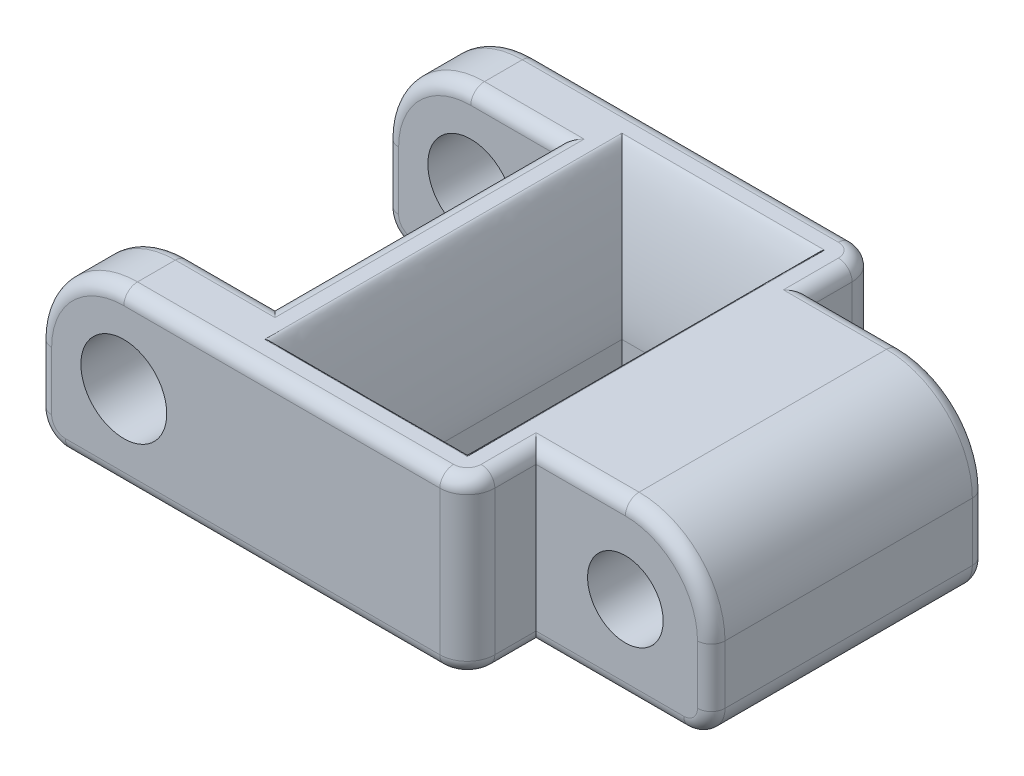
from build123d import *

# Parameters (mm, degrees)
BOSS_EXTRUDE1_DEPTH     = 5
CUT_EXTRUDE1_DEPTH      = 21.850899261
CUT_EXTRUDE1_DEPTH_BACK = 21.850899261
SKETCH2_R               = 1.1
SKETCH2_R_2             = 1.25
SKETCH3_W               = 3.5
SKETCH3_H               = 8
CUT_EXTRUDE2_DEPTH      = 22.880585001
FILLET1_R               = 2.5
FILLET2_SIZE            = 1.2
FILLET2_SIZE_2          = 4
FILLET3_R               = 0.8
FILLET4_R               = 0.4


with BuildPart() as part:
    # Sketch1 → Boss-Extrude1 (new body)
    with BuildSketch(Plane(origin=(0, 0, 0), x_dir=(1, 0, 0), z_dir=(0, 1, 0))):
        Polygon((0, -10.1), (0, -12), (12.5, -12), (12.5, -10), (17.6, -10), (17.6, -2), (12.5, -2), (12.5, 0), (0, 0), (0, -1.9), (5, -1.9), (5, -10.1), align=None)
    extrude(amount=BOSS_EXTRUDE1_DEPTH)

    # Sketch2 → Cut-Extrude1 (cut, two sides: drawn at the far end of the back side and taken through both)
    with BuildSketch(Plane.XY.offset(10).offset(-CUT_EXTRUDE1_DEPTH_BACK)):
        with Locations((15.1, 2.5)):
            Circle(SKETCH2_R)
        with Locations((2.5, 2.5)):
            Circle(SKETCH2_R_2)
    extrude(amount=CUT_EXTRUDE1_DEPTH + CUT_EXTRUDE1_DEPTH_BACK, mode=Mode.SUBTRACT)

    # Sketch3 → Cut-Extrude2 (cut, through all)
    with BuildSketch(Plane(origin=(0, 5, 0), x_dir=(1, 0, 0), z_dir=(0, 1, 0))):
        with Locations((8.75, -6)):
            Rectangle(SKETCH3_W, SKETCH3_H)
    extrude(amount=-CUT_EXTRUDE2_DEPTH, mode=Mode.SUBTRACT)

    # Fillet1
    fillet1_edges = [part.edges().sort_by_distance(p)[0] for p in [
        (0, 5, 11.05),
        (17.6, 5, 6),
        (0, 5, 0.95),
    ]]
    fillet(fillet1_edges, radius=FILLET1_R)

    # Fillet2
    # a fillet whose section is not a circle: 4, 1.2 mm, written as the material it takes off along each edge
    with BuildSketch(Plane(origin=(7, 5, 10), x_dir=(-1, 0, 0), z_dir=(0, 0, -1)), Plane(origin=(10.5, 5, 2), x_dir=(1, 0, 0), z_dir=(0, 0, 1))) as fillet2_piece_1:
        with BuildLine():
            Bezier((FILLET2_SIZE, 0), (0, 0), (0, -FILLET2_SIZE_2), weights=[1, 0.25, 1])
            Line((0, -FILLET2_SIZE_2), (-0.08, -4))
            Line((-0.08, -4), (-0.08, 0.08))
            Line((-0.08, 0.08), (1.2, 0.08))
            Line((1.2, 0.08), (FILLET2_SIZE, 0))
        make_face()
    extrude(amount=8, mode=Mode.SUBTRACT)
    with BuildSketch(Plane(origin=(10.5, 5, 10), x_dir=(0, 0, 1), z_dir=(-1, 0, 0)), Plane(origin=(7, 5, 2), x_dir=(0, 0, -1), z_dir=(1, 0, 0))) as fillet2_piece_2:
        with BuildLine():
            Bezier((FILLET2_SIZE, 0), (0, 0), (0, -FILLET2_SIZE_2), weights=[1, 0.25, 1])
            Line((0, -FILLET2_SIZE_2), (-0.08, -4))
            Line((-0.08, -4), (-0.08, 0.08))
            Line((-0.08, 0.08), (1.2, 0.08))
            Line((1.2, 0.08), (FILLET2_SIZE, 0))
        make_face()
    extrude(amount=3.5, mode=Mode.SUBTRACT)
    with BuildSketch(Plane(origin=(7, 5, 20), x_dir=(-1, 0, 0), z_dir=(0, 0, -1))) as fillet2_piece_3a_section:
        with BuildLine():
            Bezier((FILLET2_SIZE, 0), (0, 0), (0, -FILLET2_SIZE_2), weights=[1, 0.25, 1])
            Line((0, -FILLET2_SIZE_2), (-0.08, -4))
            Line((-0.08, -4), (-0.08, 0.08))
            Line((-0.08, 0.08), (1.2, 0.08))
            Line((1.2, 0.08), (FILLET2_SIZE, 0))
        make_face()
    fillet2_piece_3a = extrude(amount=18, mode=Mode.PRIVATE)
    fillet2_piece_3a = split(fillet2_piece_3a, bisect_by=Plane(origin=(7, 5, 10), z_dir=(0, 0, 1)), keep=Keep.TOP, mode=Mode.PRIVATE)
    with BuildSketch(Plane(origin=(10.5, 5, 10), x_dir=(0, 0, 1), z_dir=(-1, 0, 0))) as fillet2_piece_3b_section:
        with BuildLine():
            Bezier((FILLET2_SIZE, 0), (0, 0), (0, -FILLET2_SIZE_2), weights=[1, 0.25, 1])
            Line((0, -FILLET2_SIZE_2), (-0.08, -4))
            Line((-0.08, -4), (-0.08, 0.08))
            Line((-0.08, 0.08), (1.2, 0.08))
            Line((1.2, 0.08), (FILLET2_SIZE, 0))
        make_face()
    fillet2_piece_3b = extrude(amount=13.5, mode=Mode.PRIVATE)
    fillet2_piece_3b = split(fillet2_piece_3b, bisect_by=Plane(origin=(7, 5, 10), z_dir=(-1, 0, 0)), keep=Keep.TOP, mode=Mode.PRIVATE)
    fillet2_piece_3 = fillet2_piece_3a & fillet2_piece_3b
    add(fillet2_piece_3, mode=Mode.SUBTRACT)
    with BuildSketch(Plane(origin=(7, 5, 10), x_dir=(-1, 0, 0), z_dir=(0, 0, -1))) as fillet2_piece_4a_section:
        with BuildLine():
            Bezier((FILLET2_SIZE, 0), (0, 0), (0, -FILLET2_SIZE_2), weights=[1, 0.25, 1])
            Line((0, -FILLET2_SIZE_2), (-0.08, -4))
            Line((-0.08, -4), (-0.08, 0.08))
            Line((-0.08, 0.08), (1.2, 0.08))
            Line((1.2, 0.08), (FILLET2_SIZE, 0))
        make_face()
    fillet2_piece_4a = extrude(amount=18, mode=Mode.PRIVATE)
    fillet2_piece_4a = split(fillet2_piece_4a, bisect_by=Plane(origin=(7, 5, 2), z_dir=(0, 0, -1)), keep=Keep.TOP, mode=Mode.PRIVATE)
    with BuildSketch(Plane(origin=(-3, 5, 2), x_dir=(0, 0, -1), z_dir=(1, 0, 0))) as fillet2_piece_4b_section:
        with BuildLine():
            Bezier((FILLET2_SIZE, 0), (0, 0), (0, -FILLET2_SIZE_2), weights=[1, 0.25, 1])
            Line((0, -FILLET2_SIZE_2), (-0.08, -4))
            Line((-0.08, -4), (-0.08, 0.08))
            Line((-0.08, 0.08), (1.2, 0.08))
            Line((1.2, 0.08), (FILLET2_SIZE, 0))
        make_face()
    fillet2_piece_4b = extrude(amount=13.5, mode=Mode.PRIVATE)
    fillet2_piece_4b = split(fillet2_piece_4b, bisect_by=Plane(origin=(7, 5, 2), z_dir=(-1, 0, 0)), keep=Keep.TOP, mode=Mode.PRIVATE)
    fillet2_piece_4 = fillet2_piece_4a & fillet2_piece_4b
    add(fillet2_piece_4, mode=Mode.SUBTRACT)
    with BuildSketch(Plane(origin=(20.5, 5, 10), x_dir=(0, 0, 1), z_dir=(-1, 0, 0))) as fillet2_piece_5a_section:
        with BuildLine():
            Bezier((FILLET2_SIZE, 0), (0, 0), (0, -FILLET2_SIZE_2), weights=[1, 0.25, 1])
            Line((0, -FILLET2_SIZE_2), (-0.08, -4))
            Line((-0.08, -4), (-0.08, 0.08))
            Line((-0.08, 0.08), (1.2, 0.08))
            Line((1.2, 0.08), (FILLET2_SIZE, 0))
        make_face()
    fillet2_piece_5a = extrude(amount=13.5, mode=Mode.PRIVATE)
    fillet2_piece_5a = split(fillet2_piece_5a, bisect_by=Plane(origin=(10.5, 5, 10), z_dir=(1, 0, 0)), keep=Keep.TOP, mode=Mode.PRIVATE)
    with BuildSketch(Plane(origin=(10.5, 5, 2), x_dir=(1, 0, 0), z_dir=(0, 0, 1))) as fillet2_piece_5b_section:
        with BuildLine():
            Bezier((FILLET2_SIZE, 0), (0, 0), (0, -FILLET2_SIZE_2), weights=[1, 0.25, 1])
            Line((0, -FILLET2_SIZE_2), (-0.08, -4))
            Line((-0.08, -4), (-0.08, 0.08))
            Line((-0.08, 0.08), (1.2, 0.08))
            Line((1.2, 0.08), (FILLET2_SIZE, 0))
        make_face()
    fillet2_piece_5b = extrude(amount=18, mode=Mode.PRIVATE)
    fillet2_piece_5b = split(fillet2_piece_5b, bisect_by=Plane(origin=(10.5, 5, 10), z_dir=(0, 0, 1)), keep=Keep.TOP, mode=Mode.PRIVATE)
    fillet2_piece_5 = fillet2_piece_5a & fillet2_piece_5b
    add(fillet2_piece_5, mode=Mode.SUBTRACT)
    with BuildSketch(Plane(origin=(10.5, 5, -8), x_dir=(1, 0, 0), z_dir=(0, 0, 1))) as fillet2_piece_6a_section:
        with BuildLine():
            Bezier((FILLET2_SIZE, 0), (0, 0), (0, -FILLET2_SIZE_2), weights=[1, 0.25, 1])
            Line((0, -FILLET2_SIZE_2), (-0.08, -4))
            Line((-0.08, -4), (-0.08, 0.08))
            Line((-0.08, 0.08), (1.2, 0.08))
            Line((1.2, 0.08), (FILLET2_SIZE, 0))
        make_face()
    fillet2_piece_6a = extrude(amount=18, mode=Mode.PRIVATE)
    fillet2_piece_6a = split(fillet2_piece_6a, bisect_by=Plane(origin=(10.5, 5, 2), z_dir=(0, 0, -1)), keep=Keep.TOP, mode=Mode.PRIVATE)
    with BuildSketch(Plane(origin=(7, 5, 2), x_dir=(0, 0, -1), z_dir=(1, 0, 0))) as fillet2_piece_6b_section:
        with BuildLine():
            Bezier((FILLET2_SIZE, 0), (0, 0), (0, -FILLET2_SIZE_2), weights=[1, 0.25, 1])
            Line((0, -FILLET2_SIZE_2), (-0.08, -4))
            Line((-0.08, -4), (-0.08, 0.08))
            Line((-0.08, 0.08), (1.2, 0.08))
            Line((1.2, 0.08), (FILLET2_SIZE, 0))
        make_face()
    fillet2_piece_6b = extrude(amount=13.5, mode=Mode.PRIVATE)
    fillet2_piece_6b = split(fillet2_piece_6b, bisect_by=Plane(origin=(10.5, 5, 2), z_dir=(1, 0, 0)), keep=Keep.TOP, mode=Mode.PRIVATE)
    fillet2_piece_6 = fillet2_piece_6a & fillet2_piece_6b
    add(fillet2_piece_6, mode=Mode.SUBTRACT)

    # Fillet3
    fillet3_edges = [part.edges().sort_by_distance(p)[0] for p in [
        (17.6, 0, 6),
        (0, 0, 11.05),
        (0, 0, 0.95),
        (12.5, 2.5, 0),
        (12.5, 2.5, 12),
    ]]
    fillet(fillet3_edges, radius=FILLET3_R)

    # Fillet4
    fillet4_edges = [part.edges().sort_by_distance(p)[0] for p in [
        (2.9, 0, 1.9),
        (0.234314575, 0.234314575, 1.9),
        (6.25, 0, 0),
        (14.65, 0, 2),
        (12.5, 0, 10.6),
        (6.25, 0, 12),
        (12.265685425, 0, 11.765685425),
        (12.265685425, 0, 0.234314575),
        (7.1, 5, 0),
        (0.234314575, 0.234314575, 0),
        (0.234314575, 0.234314575, 12),
        (0.234314575, 0.234314575, 10.1),
        (17.365685425, 0.234314575, 2),
        (17.365685425, 0.234314575, 10),
        (12.5, 5, 10.6),
        (12.265685425, 5, 11.765685425),
        (12.265685425, 5, 0.234314575),
        (12.5, 0, 1.4),
        (5, 5, 6),
        (14.65, 0, 10),
        (2.9, 0, 10.1),
        (3.75, 5, 10.1),
        (13.8, 5, 10),
        (12.5, 5, 1.4),
        (3.75, 5, 1.9),
        (7.1, 5, 12),
        (13.8, 5, 2),
        (0, 1.65, 1.9),
        (0.732233047, 4.267766953, 1.9),
        (0, 1.65, 0),
        (0.732233047, 4.267766953, 0),
        (0, 1.65, 12),
        (0.732233047, 4.267766953, 12),
        (0, 1.65, 10.1),
        (0.732233047, 4.267766953, 10.1),
        (17.6, 1.65, 2),
        (16.867766953, 4.267766953, 2),
        (17.6, 1.65, 10),
        (16.867766953, 4.267766953, 10),
    ]]
    fillet(fillet4_edges, radius=FILLET4_R)


solid = part.part
